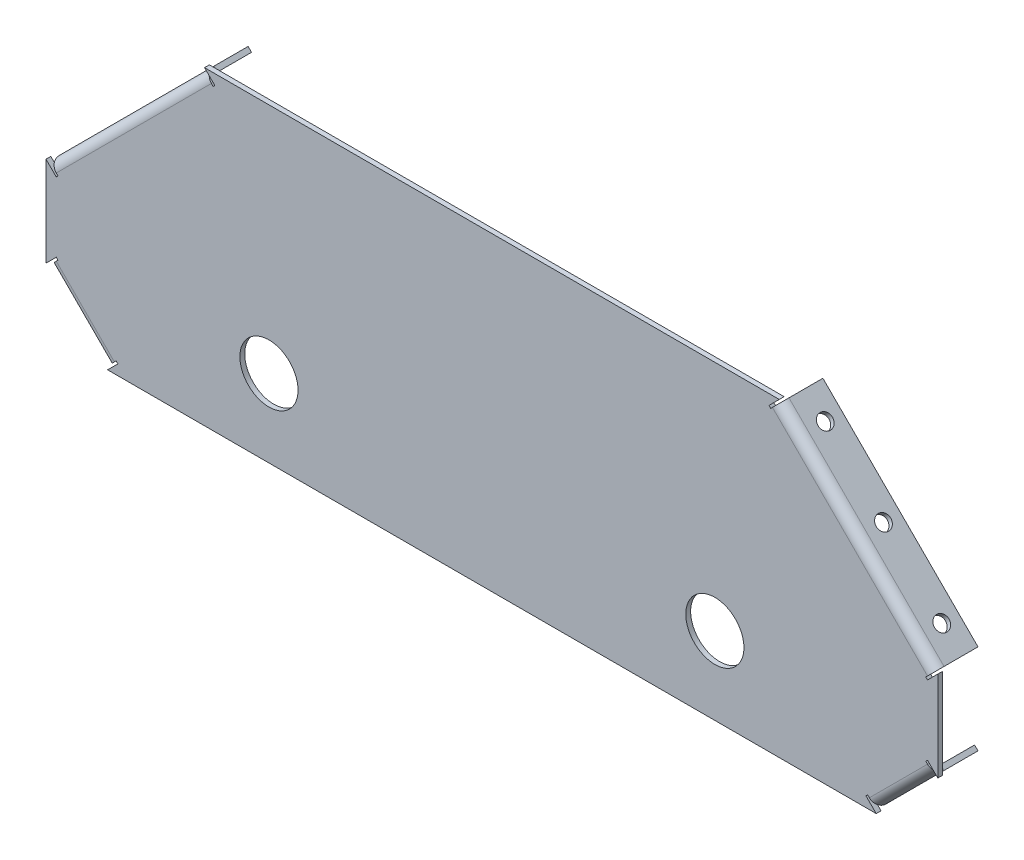
from build123d import *

# Parameters (mm, degrees)
BASE_FLANGE1_START    = -3.175
BASE_FLANGE1_DEPTH    = 6.35
EDGE_FLANGE1_START    = 152.664354058
EDGE_FLANGE1_DEPTH    = 287.368195874
EDGE_FLANGE1_START_2  = -296.348451995
EDGE_FLANGE1_2_DEPTH  = 107.763073453
EDGE_FLANGE1_START_3  = -826.183563138
EDGE_FLANGE1_3_DEPTH  = 287.368195874
EDGE_FLANGE1_START_4  = -197.565634664
EDGE_FLANGE1_4_DEPTH  = 107.763073453
EDGE_FLANGE1_START_5  = 149.489354058
EDGE_FLANGE1_5_DEPTH  = 293.718195874
EDGE_FLANGE1_START_6  = -299.523451995
EDGE_FLANGE1_6_DEPTH  = 114.113073453
EDGE_FLANGE1_7_DEPTH  = 3.175
EDGE_FLANGE1_START_7  = -188.585378542
EDGE_FLANGE1_8_DEPTH  = 3.175
EDGE_FLANGE1_9_DEPTH  = 3.175
EDGE_FLANGE1_START_8  = 440.032549932
EDGE_FLANGE1_10_DEPTH = 3.175
EDGE_FLANGE1_START_9  = -829.358563138
EDGE_FLANGE1_11_DEPTH = 293.718195874
EDGE_FLANGE1_START_10 = -200.740634664
EDGE_FLANGE1_12_DEPTH = 114.113073453
EDGE_FLANGE1_13_DEPTH = 3.175
EDGE_FLANGE1_START_11 = -538.815367264
EDGE_FLANGE1_14_DEPTH = 3.175
EDGE_FLANGE1_15_DEPTH = 3.175
EDGE_FLANGE1_START_12 = -89.802561211
EDGE_FLANGE1_16_DEPTH = 3.175
SKETCH21_R            = 9.525
CUT_EXTRUDE1_DEPTH    = 6.35
SKETCH22_R            = 9.525
CUT_EXTRUDE2_DEPTH    = 6.35
SKETCH29_R            = 9.525
CUT_EXTRUDE5_DEPTH    = 6.35
SKETCH30_R            = 9.525
CUT_EXTRUDE6_DEPTH    = 6.35
SKETCH31_R            = 38.1
CUT_EXTRUDE7_DEPTH    = 6.35


# Read off the part's stored shape, not the designer's step: Base-Flange1, Edge-Flange1
with BuildPart() as part:
    # Base-Flange1 outline → Base-Flange1 (new body)
    with BuildSketch(Plane.XY.offset(BASE_FLANGE1_START)):
        Polygon((-508, -241.3), (508, -241.3), (584.2, -165.1), (584.2, -38.1), (381, 165.1), (-381, 165.1), (-584.2, -38.1), (-584.2, -165.1), align=None)
    extrude(amount=BASE_FLANGE1_DEPTH)

    # Edge-Flange1 outline → Edge-Flange1 (add)
    with BuildSketch(Plane(origin=(0, 0, 0), x_dir=(0.7071067811865474, 0.7071067811865477, 0), z_dir=(0.7071067811865476, -0.7071067811865476, 0)).offset(EDGE_FLANGE1_START)):
        with BuildLine():
            Line((378.099535834, -3.175), (367.101013206, -3.175))
            ThreePointArc((367.101013206, -3.175), (371.591141267, -5.034871939), (373.451013206, -9.525))
            Line((373.451013206, -9.525), (373.451013206, -53.975))
            Line((373.451013206, -53.975), (379.801013206, -53.975))
            Line((379.801013206, -53.975), (379.801013206, -9.525))
            ThreePointArc((379.801013206, -9.525), (379.3682712, -6.237998127), (378.099535834, -3.175))
        make_face()
    extrude(amount=EDGE_FLANGE1_DEPTH)

    # Edge-Flange1 2 outline → Edge-Flange1 2 (add)
    with BuildSketch(Plane(origin=(0, 0, 0), x_dir=(0.7071067811865474, 0.7071067811865477, 0), z_dir=(0.7071067811865476, -0.7071067811865476, 0)).offset(EDGE_FLANGE1_START_2)):
        with BuildLine():
            ThreePointArc((-517.135111143, -9.525), (-515.275239204, -5.034871939), (-510.785111143, -3.175))
            Line((-510.785111143, -3.175), (-521.783633771, -3.175))
            ThreePointArc((-521.783633771, -3.175), (-523.052369137, -6.237998127), (-523.485111143, -9.525))
            Line((-523.485111143, -9.525), (-523.485111143, -53.975))
            Line((-523.485111143, -53.975), (-517.135111143, -53.975))
            Line((-517.135111143, -53.975), (-517.135111143, -9.525))
        make_face()
    extrude(amount=EDGE_FLANGE1_2_DEPTH)

    # Edge-Flange1 3 outline → Edge-Flange1 3 (add)
    with BuildSketch(Plane(origin=(273.05, 273.05, -3.175), x_dir=(0.7071067811865481, -0.7071067811865469, 0), z_dir=(0.7071067811865469, 0.7071067811865481, 3.4914813388431334e-15)).offset(EDGE_FLANGE1_START_3)):
        with BuildLine():
            Line((-378.099535834, 0), (-367.101013206, 0))
            ThreePointArc((-367.101013206, 0), (-371.591141267, 1.859871939), (-373.451013206, 6.35))
            Line((-373.451013206, 6.35), (-373.451013206, 50.8))
            Line((-373.451013206, 50.8), (-379.801013206, 50.8))
            Line((-379.801013206, 50.8), (-379.801013206, 6.35))
            ThreePointArc((-379.801013206, 6.35), (-379.3682712, 3.062998127), (-378.099535834, 0))
        make_face()
    extrude(amount=EDGE_FLANGE1_3_DEPTH)

    # Edge-Flange1 4 outline → Edge-Flange1 4 (add)
    with BuildSketch(Plane(origin=(273.05, 273.05, -3.175), x_dir=(0.7071067811865481, -0.7071067811865469, 0), z_dir=(0.7071067811865469, 0.7071067811865481, 3.4914813388431334e-15)).offset(EDGE_FLANGE1_START_4)):
        with BuildLine():
            ThreePointArc((517.135111143, 6.35), (515.275239204, 1.859871939), (510.785111143, 0))
            Line((510.785111143, 0), (521.783633771, 0))
            ThreePointArc((521.783633771, 0), (523.052369137, 3.062998127), (523.485111143, 6.35))
            Line((523.485111143, 6.35), (523.485111143, 50.8))
            Line((523.485111143, 50.8), (517.135111143, 50.8))
            Line((517.135111143, 50.8), (517.135111143, 6.35))
        make_face()
    extrude(amount=EDGE_FLANGE1_4_DEPTH)

    # Edge-Flange1 5 outline → Edge-Flange1 5 (cut)
    with BuildSketch(Plane(origin=(0, 0, 0), x_dir=(0.7071067811865474, 0.7071067811865477, 0), z_dir=(0.7071067811865476, -0.7071067811865476, 0)).offset(EDGE_FLANGE1_START_5)):
        with BuildLine():
            Line((386.151013206, 3.175), (367.101013206, 3.175))
            ThreePointArc((367.101013206, 3.175), (373.451013206, 1.473522628), (378.099535834, -3.175))
            Line((378.099535834, -3.175), (386.151013206, -3.175))
            Line((386.151013206, -3.175), (386.151013206, 3.175))
        make_face()
    extrude(amount=EDGE_FLANGE1_5_DEPTH, mode=Mode.SUBTRACT)

    # Edge-Flange1 6 outline → Edge-Flange1 6 (cut)
    with BuildSketch(Plane(origin=(0, 0, 0), x_dir=(0.7071067811865474, 0.7071067811865477, 0), z_dir=(0.7071067811865476, -0.7071067811865476, 0)).offset(EDGE_FLANGE1_START_6)):
        with BuildLine():
            ThreePointArc((-521.783633771, -3.175), (-517.135111143, 1.473522628), (-510.785111143, 3.175))
            Line((-510.785111143, 3.175), (-529.835111143, 3.175))
            Line((-529.835111143, 3.175), (-529.835111143, -3.175))
            Line((-529.835111143, -3.175), (-521.783633771, -3.175))
        make_face()
    extrude(amount=EDGE_FLANGE1_6_DEPTH, mode=Mode.SUBTRACT)

    # Edge-Flange1 7 outline → Edge-Flange1 7 (cut)
    with BuildSketch(Plane(origin=(0, 0, 0), x_dir=(0.7071067811865474, 0.7071067811865477, 0), z_dir=(0.7071067811865476, -0.7071067811865476, 0)).offset(EDGE_FLANGE1_START_6)):
        with BuildLine():
            Line((-521.783633771, -3.175), (-507.610111143, -3.175))
            Line((-507.610111143, -3.175), (-507.610111143, 3.175))
            Line((-507.610111143, 3.175), (-510.785111143, 3.175))
            ThreePointArc((-510.785111143, 3.175), (-517.135111143, 1.473522628), (-521.783633771, -3.175))
        make_face()
    extrude(amount=EDGE_FLANGE1_7_DEPTH, mode=Mode.SUBTRACT)

    # Edge-Flange1 8 outline → Edge-Flange1 8 (cut)
    with BuildSketch(Plane(origin=(0, 0, 0), x_dir=(0.7071067811865474, 0.7071067811865477, 0), z_dir=(0.7071067811865476, -0.7071067811865476, 0)).offset(EDGE_FLANGE1_START_7)):
        with BuildLine():
            Line((-521.783633771, -3.175), (-507.610111143, -3.175))
            Line((-507.610111143, -3.175), (-507.610111143, 3.175))
            Line((-507.610111143, 3.175), (-510.785111143, 3.175))
            ThreePointArc((-510.785111143, 3.175), (-517.135111143, 1.473522628), (-521.783633771, -3.175))
        make_face()
    extrude(amount=EDGE_FLANGE1_8_DEPTH, mode=Mode.SUBTRACT)

    # Edge-Flange1 9 outline → Edge-Flange1 9 (cut)
    with BuildSketch(Plane(origin=(0, 0, 0), x_dir=(0.7071067811865474, 0.7071067811865477, 0), z_dir=(0.7071067811865476, -0.7071067811865476, 0)).offset(EDGE_FLANGE1_START_5)):
        with BuildLine():
            Line((363.926013206, 3.175), (363.926013206, -3.175))
            Line((363.926013206, -3.175), (378.099535834, -3.175))
            ThreePointArc((378.099535834, -3.175), (373.451013206, 1.473522628), (367.101013206, 3.175))
            Line((367.101013206, 3.175), (363.926013206, 3.175))
        make_face()
    extrude(amount=EDGE_FLANGE1_9_DEPTH, mode=Mode.SUBTRACT)

    # Edge-Flange1 10 outline → Edge-Flange1 10 (cut)
    with BuildSketch(Plane(origin=(0, 0, 0), x_dir=(0.7071067811865474, 0.7071067811865477, 0), z_dir=(0.7071067811865476, -0.7071067811865476, 0)).offset(EDGE_FLANGE1_START_8)):
        with BuildLine():
            Line((363.926013206, 3.175), (363.926013206, -3.175))
            Line((363.926013206, -3.175), (378.099535834, -3.175))
            ThreePointArc((378.099535834, -3.175), (373.451013206, 1.473522628), (367.101013206, 3.175))
            Line((367.101013206, 3.175), (363.926013206, 3.175))
        make_face()
    extrude(amount=EDGE_FLANGE1_10_DEPTH, mode=Mode.SUBTRACT)

    # Edge-Flange1 11 outline → Edge-Flange1 11 (cut)
    with BuildSketch(Plane(origin=(273.05, 273.05, -3.175), x_dir=(0.7071067811865481, -0.7071067811865469, 0), z_dir=(0.7071067811865469, 0.7071067811865481, 3.4914813388431334e-15)).offset(EDGE_FLANGE1_START_9)):
        with BuildLine():
            Line((-386.151013206, -6.35), (-367.101013206, -6.35))
            ThreePointArc((-367.101013206, -6.35), (-373.451013206, -4.648522628), (-378.099535834, 0))
            Line((-378.099535834, 0), (-386.151013206, 0))
            Line((-386.151013206, 0), (-386.151013206, -6.35))
        make_face()
    extrude(amount=EDGE_FLANGE1_11_DEPTH, mode=Mode.SUBTRACT)

    # Edge-Flange1 12 outline → Edge-Flange1 12 (cut)
    with BuildSketch(Plane(origin=(273.05, 273.05, -3.175), x_dir=(0.7071067811865481, -0.7071067811865469, 0), z_dir=(0.7071067811865469, 0.7071067811865481, 3.4914813388431334e-15)).offset(EDGE_FLANGE1_START_10)):
        with BuildLine():
            ThreePointArc((521.783633771, 0), (517.135111143, -4.648522628), (510.785111143, -6.35))
            Line((510.785111143, -6.35), (529.835111143, -6.35))
            Line((529.835111143, -6.35), (529.835111143, 0))
            Line((529.835111143, 0), (521.783633771, 0))
        make_face()
    extrude(amount=EDGE_FLANGE1_12_DEPTH, mode=Mode.SUBTRACT)

    # Edge-Flange1 13 outline → Edge-Flange1 13 (cut)
    with BuildSketch(Plane(origin=(273.05, 273.05, -3.175), x_dir=(0.7071067811865481, -0.7071067811865469, 0), z_dir=(0.7071067811865469, 0.7071067811865481, 3.4914813388431334e-15)).offset(EDGE_FLANGE1_START_9)):
        with BuildLine():
            Line((-363.926013206, -6.35), (-363.926013206, 0))
            Line((-363.926013206, 0), (-378.099535834, 0))
            ThreePointArc((-378.099535834, 0), (-373.451013206, -4.648522628), (-367.101013206, -6.35))
            Line((-367.101013206, -6.35), (-363.926013206, -6.35))
        make_face()
    extrude(amount=EDGE_FLANGE1_13_DEPTH, mode=Mode.SUBTRACT)

    # Edge-Flange1 14 outline → Edge-Flange1 14 (cut)
    with BuildSketch(Plane(origin=(273.05, 273.05, -3.175), x_dir=(0.7071067811865481, -0.7071067811865469, 0), z_dir=(0.7071067811865469, 0.7071067811865481, 3.4914813388431334e-15)).offset(EDGE_FLANGE1_START_11)):
        with BuildLine():
            Line((-363.926013206, -6.35), (-363.926013206, 0))
            Line((-363.926013206, 0), (-378.099535834, 0))
            ThreePointArc((-378.099535834, 0), (-373.451013206, -4.648522628), (-367.101013206, -6.35))
            Line((-367.101013206, -6.35), (-363.926013206, -6.35))
        make_face()
    extrude(amount=EDGE_FLANGE1_14_DEPTH, mode=Mode.SUBTRACT)

    # Edge-Flange1 15 outline → Edge-Flange1 15 (cut)
    with BuildSketch(Plane(origin=(273.05, 273.05, -3.175), x_dir=(0.7071067811865481, -0.7071067811865469, 0), z_dir=(0.7071067811865469, 0.7071067811865481, 3.4914813388431334e-15)).offset(EDGE_FLANGE1_START_10)):
        with BuildLine():
            Line((521.783633771, 0), (507.610111143, 0))
            Line((507.610111143, 0), (507.610111143, -6.35))
            Line((507.610111143, -6.35), (510.785111143, -6.35))
            ThreePointArc((510.785111143, -6.35), (517.135111143, -4.648522628), (521.783633771, 0))
        make_face()
    extrude(amount=EDGE_FLANGE1_15_DEPTH, mode=Mode.SUBTRACT)

    # Edge-Flange1 16 outline → Edge-Flange1 16 (cut)
    with BuildSketch(Plane(origin=(273.05, 273.05, -3.175), x_dir=(0.7071067811865481, -0.7071067811865469, 0), z_dir=(0.7071067811865469, 0.7071067811865481, 3.4914813388431334e-15)).offset(EDGE_FLANGE1_START_12)):
        with BuildLine():
            Line((521.783633771, 0), (507.610111143, 0))
            Line((507.610111143, 0), (507.610111143, -6.35))
            Line((507.610111143, -6.35), (510.785111143, -6.35))
            ThreePointArc((510.785111143, -6.35), (517.135111143, -4.648522628), (521.783633771, 0))
        make_face()
    extrude(amount=EDGE_FLANGE1_16_DEPTH, mode=Mode.SUBTRACT)

    # Sketch21 → Cut-Extrude1 (cut)
    with BuildSketch(Plane(origin=(268.559871939, 268.559871939, 0), x_dir=(0, 0, -1), z_dir=(0.7071067811865468, 0.7071067811865483, 1.5453665931926906e-15))):
        with Locations(Location((31.75, -188.398458358, 0), (0, 0, 90))):
            Circle(SKETCH21_R)
        with Locations(Location((31.75, -296.348458358, 0), (0, 0, 90))):
            Circle(SKETCH21_R)
        with Locations(Location((31.75, -404.298458358, 0), (0, 0, 90))):
            Circle(SKETCH21_R)
    extrude(amount=-CUT_EXTRUDE1_DEPTH, mode=Mode.SUBTRACT)

    # Sketch22 → Cut-Extrude2 (cut)
    with BuildSketch(Plane(origin=(-268.559871939, 268.559871939, 0), x_dir=(0, 0, 1), z_dir=(-0.707106781186548, 0.7071067811865471, 4.2497581312798994e-15))):
        with Locations(Location((-31.75, -188.398458358, 0), (0, 0, 270))):
            Circle(SKETCH22_R)
        with Locations(Location((-31.75, -296.348458358, 0), (0, 0, 270))):
            Circle(SKETCH22_R)
        with Locations(Location((-31.75, -404.298458358, 0), (0, 0, 270))):
            Circle(SKETCH22_R)
    extrude(amount=-CUT_EXTRUDE2_DEPTH, mode=Mode.SUBTRACT)

    # Sketch29 → Cut-Extrude5 (cut)
    with BuildSketch(Plane(origin=(370.159871939, -370.159871939, 0), x_dir=(0, 0, -1), z_dir=(0.7071067811865457, -0.7071067811865493, 4.2497581312799065e-15))):
        with Locations(Location((31.75, 242.500451995, 0), (0, 0, 90))):
            Circle(SKETCH29_R)
    extrude(amount=-CUT_EXTRUDE5_DEPTH, mode=Mode.SUBTRACT)

    # Sketch30 → Cut-Extrude6 (cut)
    with BuildSketch(Plane(origin=(-370.159871939, -370.159871939, 0), x_dir=(0, 0, 1), z_dir=(-0.7071067811865476, -0.7071067811865476, 3.0907331863853848e-15))):
        with Locations(Location((-31.75, 242.433378542, 0), (0, 0, 270))):
            Circle(SKETCH30_R)
    extrude(amount=-CUT_EXTRUDE6_DEPTH, mode=Mode.SUBTRACT)

    # Sketch31 → Cut-Extrude7 (cut)
    with BuildSketch(Plane.XY.offset(3.175)):
        with Locations((-292.1, -139.7)):
            Circle(SKETCH31_R)
        with Locations((292.1, -139.7)):
            Circle(SKETCH31_R)
    extrude(amount=-CUT_EXTRUDE7_DEPTH, mode=Mode.SUBTRACT)


solid = part.part
